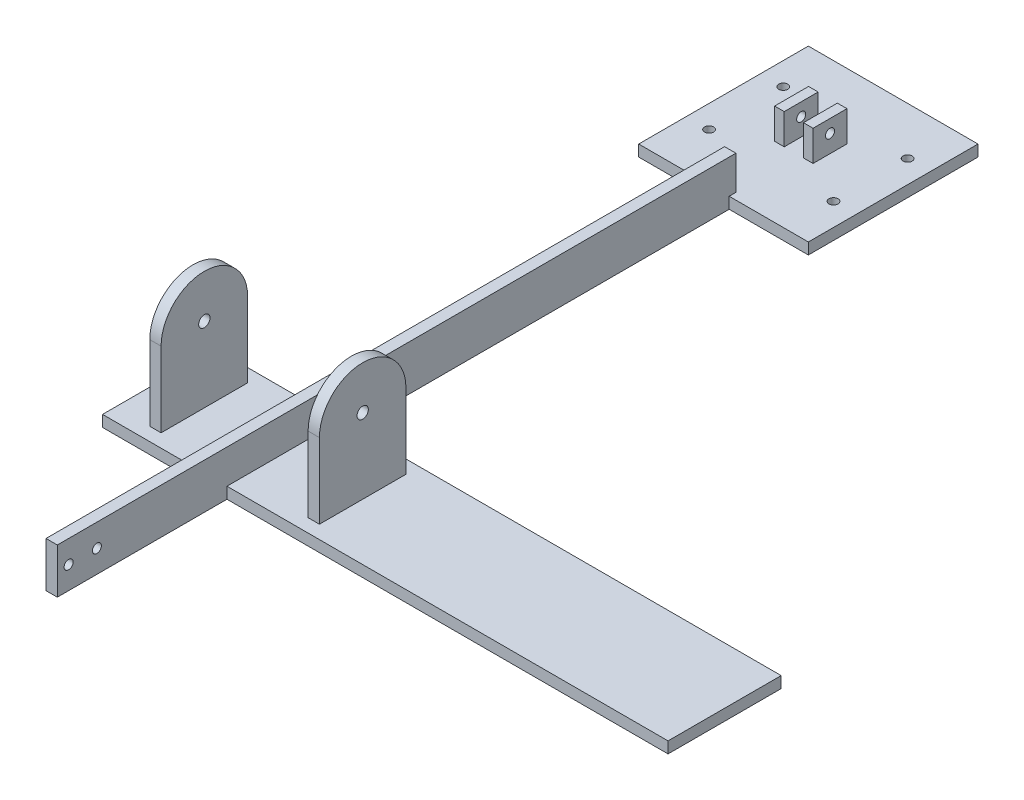
from build123d import *

# Parameters (mm, degrees)
SKETCH2_W           = 150
SKETCH2_H           = 150
SKETCH2_R           = 4
BOSS_EXTRUDE2_DEPTH = 10
SKETCH3_W           = 10
SKETCH3_H           = 600
BOSS_EXTRUDE3_DEPTH = 40
SKETCH4_W           = 500
SKETCH4_H           = 100
BOSS_EXTRUDE4_DEPTH = 10
SKETCH5_R           = 5
BOSS_EXTRUDE5_DEPTH = 10
SKETCH7_W           = 30
SKETCH7_H           = 27
SKETCH7_R           = 4
BOSS_EXTRUDE6_DEPTH = 8.5
SKETCH8_R           = 4
CUT_EXTRUDE1_DEPTH  = 720.805795864


with BuildPart() as part:
    # Sketch2 → Boss-Extrude2 (new body)
    with BuildSketch(Plane(origin=(0, 0, 0), x_dir=(1, 0, 0), z_dir=(0, 1, 0))):
        with Locations((-75, 75)):
            Rectangle(SKETCH2_W, SKETCH2_H)
        with Locations((-130, 42.241144312)):
            Circle(SKETCH2_R, mode=Mode.SUBTRACT)
        with Locations((-20, 42.241144312)):
            Circle(SKETCH2_R, mode=Mode.SUBTRACT)
        with Locations((-20, 107.758855688)):
            Circle(SKETCH2_R, mode=Mode.SUBTRACT)
        with Locations((-130, 107.758855688)):
            Circle(SKETCH2_R, mode=Mode.SUBTRACT)
    extrude(amount=BOSS_EXTRUDE2_DEPTH)

    # Sketch3 → Boss-Extrude3 (add)
    with BuildSketch(Plane(origin=(0, 0, 0), x_dir=(1, 0, 0), z_dir=(0, 1, 0))):
        with Locations((-75, -294.045278836)):
            Rectangle(SKETCH3_W, SKETCH3_H)
    extrude(amount=BOSS_EXTRUDE3_DEPTH)

    # Sketch4 → Boss-Extrude4 (add)
    with BuildSketch(Plane(origin=(0, 0, 0), x_dir=(1, 0, 0), z_dir=(0, 1, 0))):
        with Locations((70, -394.045278836)):
            Rectangle(SKETCH4_W, SKETCH4_H)
    extrude(amount=BOSS_EXTRUDE4_DEPTH)

    # Sketch5 → Boss-Extrude5 (add)
    with BuildSketch(Plane(origin=(0, 0, 0), x_dir=(0, 0, -1), z_dir=(1, 0, 0))):
        with BuildLine():
            Line((-432.285278836, 10), (-432.285278836, 76.348788506))
            ThreePointArc((-432.285278836, 76.348788506), (-421.085042149, 103.388551818), (-394.045278836, 114.588788506))
            ThreePointArc((-394.045278836, 114.588788506), (-367.005515524, 103.388551818), (-355.805278836, 76.348788506))
            Line((-355.805278836, 76.348788506), (-355.805278836, 10))
            Line((-355.805278836, 10), (-432.285278836, 10))
        make_face()
        with Locations((-394.045278836, 76.348788506)):
            Circle(SKETCH5_R, mode=Mode.SUBTRACT)
    boss_extrude5 = extrude(amount=-BOSS_EXTRUDE5_DEPTH)

    # Mirror1: Boss-Extrude5 across plane
    add(boss_extrude5.mirror(Plane(origin=(-75, 0, 0), x_dir=(0, 0, 1), z_dir=(1, 0, 0))))

    # Sketch7 → Boss-Extrude6 (add)
    with BuildSketch(Plane(origin=(-58, 0, 0), x_dir=(0, 0, -1), z_dir=(1, 0, 0))):
        with Locations((77.164979512, 23.5)):
            Rectangle(SKETCH7_W, SKETCH7_H)
        with Locations((77.164979512, 25.524498442)):
            Circle(SKETCH7_R, mode=Mode.SUBTRACT)
    boss_extrude6 = extrude(amount=-BOSS_EXTRUDE6_DEPTH)

    # Mirror2: Boss-Extrude6 across plane
    add(boss_extrude6.mirror(Plane(origin=(-75, 0, 0), x_dir=(0, 0, 1), z_dir=(1, 0, 0))))

    # Sketch8 → Cut-Extrude1 (cut, through all)
    with BuildSketch(Plane(origin=(-70, 0, 0), x_dir=(0, 0, -1), z_dir=(1, 0, 0))):
        with Locations((-584.045278836, 20)):
            Circle(SKETCH8_R)
        with Locations((-559.045278836, 20)):
            Circle(SKETCH8_R)
    extrude(amount=-CUT_EXTRUDE1_DEPTH, mode=Mode.SUBTRACT)


solid = part.part
